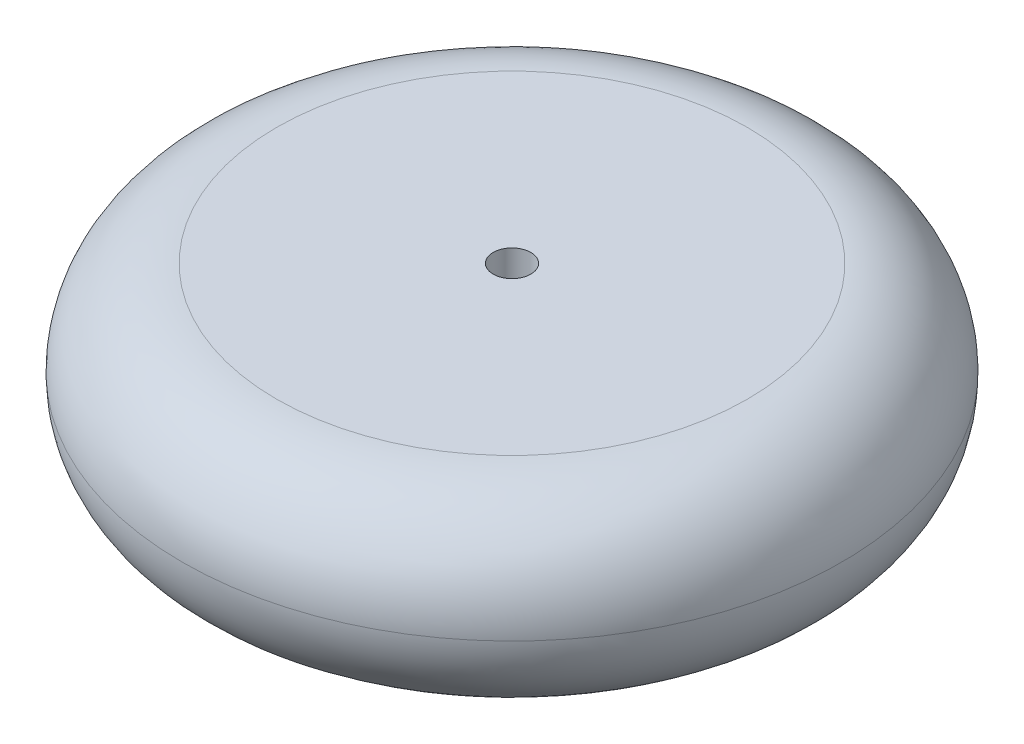
from build123d import *

# Parameters (mm, degrees)
SKETCH1_R           = 7
SKETCH1_R_2         = 0.4
BOSS_EXTRUDE1_DEPTH = 4
FILLET1_R           = 2


with BuildPart() as part:
    # Sketch1 → Boss-Extrude1 (new body)
    with BuildSketch(Plane(origin=(0, 0, 0), x_dir=(1, 0, 0), z_dir=(0, 1, 0))):
        with Locations(Location((0, 0, 0), (0, 0, 270))):
            Circle(SKETCH1_R)
        with Locations(Location((0, 0, 0), (0, 0, 270))):
            Circle(SKETCH1_R_2, mode=Mode.SUBTRACT)
    extrude(amount=BOSS_EXTRUDE1_DEPTH)

    # Fillet1
    fillet1_edges = [part.edges().sort_by_distance(p)[0] for p in [
        (0, 0, -7),
        (0, 4, -7),
    ]]
    fillet(fillet1_edges, radius=FILLET1_R - 0.0001)  # a hair under: the kernel refuses the full size


solid = part.part
